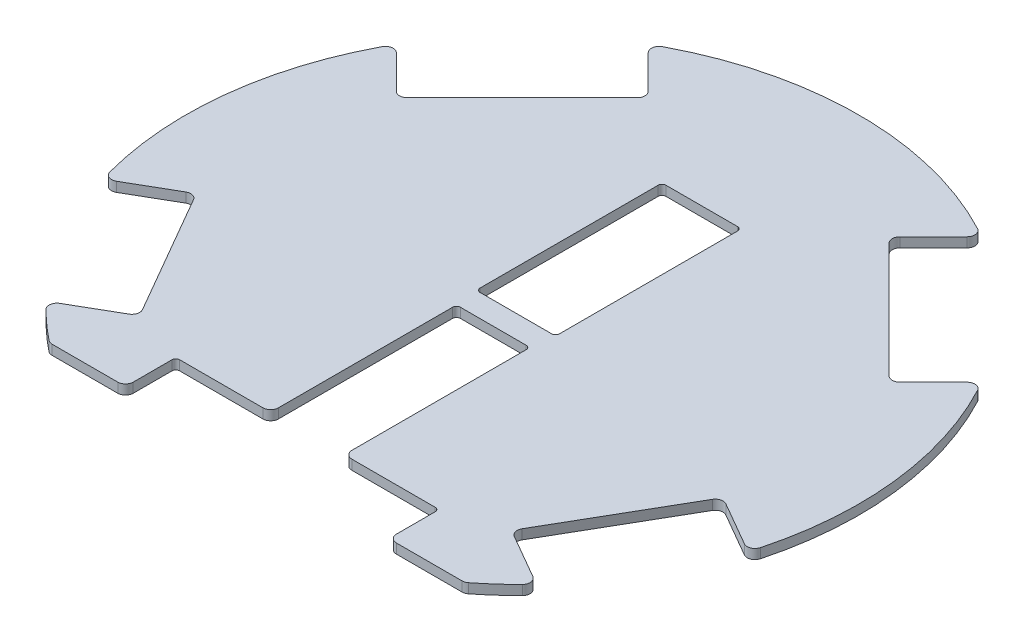
from build123d import *

# Parameters (mm, degrees)
RESSALTO_EXTRUS_O1_DEPTH = 2.5
ESBO_O13_W               = 20.5
ESBO_O13_H               = 48
CORTE_EXTRUS_O8_DEPTH    = 124.061976256
FILETE1_R                = 2
FILETE2_R                = 1


# Read off the part's stored shape, not the designer's step: Ressalto-extrusão1
with BuildPart() as part:
    # Ressalto-extrusão1 outline → Ressalto-extrusão1 (new body)
    with BuildSketch(Plane(origin=(0, 0, 0), x_dir=(1, 0, 0), z_dir=(0, 1, 0))):
        with BuildLine():
            ThreePointArc((41.182170498, 73.709082433), (41.745717904, 75.420720863), (40.703673569, 76.89090296))
            ThreePointArc((40.703673569, 76.89090296), (0, 87), (-40.703673569, 76.89090296))
            ThreePointArc((-40.703673569, 76.89090296), (-41.745717904, 75.420720863), (-41.182170498, 73.709082433))
            Line((-41.182170498, 73.709082433), (-32.526911935, 65.053823869))
            ThreePointArc((-32.526911935, 65.053823869), (-31.941125497, 63.639610306), (-32.526911935, 62.225396744))
            Line((-32.526911935, 62.225396744), (-62.225396744, 32.526911935))
            ThreePointArc((-62.225396744, 32.526911935), (-63.639610306, 31.941125497), (-65.053823869, 32.526911935))
            Line((-65.053823869, 32.526911935), (-73.709082433, 41.182170498))
            ThreePointArc((-73.709082433, 41.182170498), (-75.420720863, 41.745717904), (-76.89090296, 40.703673569))
            ThreePointArc((-76.89090296, 40.703673569), (-86.449685697, 9.769945899), (-84.035651423, -22.516866789))
            ThreePointArc((-84.035651423, -22.516866789), (-82.869168521, -23.846994955), (-81.103797367, -23.731288475))
            Line((-81.103797367, -23.731288475), (-69.755752861, -17.179491924))
            ThreePointArc((-69.755752861, -17.179491924), (-68.238114771, -16.979691079), (-67.023702054, -17.911542732))
            Line((-67.023702054, -17.911542732), (-49.023702054, -49.088457268))
            ThreePointArc((-49.023702054, -49.088457268), (-48.823901209, -50.606095358), (-49.755752861, -51.820508076))
            Line((-49.755752861, -51.820508076), (-61.103797367, -58.372304626))
            ThreePointArc((-61.103797367, -58.372304626), (-62.086687696, -59.843307652), (-61.518004364, -61.518575561))
            ThreePointArc((-61.518004364, -61.518575561), (-57.944854795, -64.895252544), (-54.186675605, -68.064705882))
            ThreePointArc((-54.186675605, -68.064705882), (-53.600773132, -68.388042871), (-52.941004902, -68.5))
            Line((-52.941004902, -68.5), (52.941004902, -68.5))
            ThreePointArc((52.941004902, -68.5), (53.600773132, -68.388042871), (54.186675605, -68.064705882))
            ThreePointArc((54.186675605, -68.064705882), (57.944854795, -64.895252544), (61.518004364, -61.518575561))
            ThreePointArc((61.518004364, -61.518575561), (62.086687696, -59.843307652), (61.103797367, -58.372304626))
            Line((61.103797367, -58.372304626), (49.755752861, -51.820508076))
            ThreePointArc((49.755752861, -51.820508076), (48.823901209, -50.606095358), (49.023702054, -49.088457268))
            Line((49.023702054, -49.088457268), (67.023702054, -17.911542732))
            ThreePointArc((67.023702054, -17.911542732), (68.238114771, -16.979691079), (69.755752861, -17.179491924))
            Line((69.755752861, -17.179491924), (81.103797367, -23.731288475))
            ThreePointArc((81.103797367, -23.731288475), (82.869168521, -23.846994955), (84.035651423, -22.516866789))
            ThreePointArc((84.035651423, -22.516866789), (86.449685697, 9.769945899), (76.89090296, 40.703673569))
            ThreePointArc((76.89090296, 40.703673569), (75.420720863, 41.745717904), (73.709082433, 41.182170498))
            Line((73.709082433, 41.182170498), (65.053823869, 32.526911935))
            ThreePointArc((65.053823869, 32.526911935), (63.639610306, 31.941125497), (62.225396744, 32.526911935))
            Line((62.225396744, 32.526911935), (32.526911935, 62.225396744))
            ThreePointArc((32.526911935, 62.225396744), (31.941125497, 63.639610306), (32.526911935, 65.053823869))
            Line((32.526911935, 65.053823869), (41.182170498, 73.709082433))
        make_face()
    extrude(amount=RESSALTO_EXTRUS_O1_DEPTH)

    # Esboço13 → Corte-extrusão8 (cut, through all)
    with BuildSketch(Plane.XZ):
        with BuildLine():
            ThreePointArc((-9.5, 67.5), (-9.207106781, 68.207106781), (-8.5, 68.5))
            Line((-8.5, 68.5), (-34, 68.5))
            Line((-34, 68.5), (-34, 55.5))
            Line((-34, 55.5), (-9.5, 55.5))
            Line((-9.5, 55.5), (-9.5, 67.5))
        make_face()
        with BuildLine():
            Line((34, 68.5), (8.5, 68.5))
            ThreePointArc((8.5, 68.5), (9.207106781, 68.207106781), (9.5, 67.5))
            Line((9.5, 67.5), (9.5, 55.5))
            Line((9.5, 55.5), (34, 55.5))
            Line((34, 55.5), (34, 68.5))
        make_face()
        with BuildLine():
            Line((8.5, 68.5), (-8.5, 68.5))
            ThreePointArc((-8.5, 68.5), (-9.207106781, 68.207106781), (-9.5, 67.5))
            Line((-9.5, 67.5), (-9.5, 55.5))
            Line((-9.5, 55.5), (9.5, 55.5))
            Line((9.5, 55.5), (9.5, 67.5))
            ThreePointArc((9.5, 67.5), (9.207106781, 68.207106781), (8.5, 68.5))
        make_face()
        with BuildLine():
            Line((9.5, 55.5), (-9.5, 55.5))
            Line((-9.5, 55.5), (-9.5, 8.5))
            ThreePointArc((-9.5, 8.5), (-9.207106781, 7.792893219), (-8.5, 7.5))
            Line((-8.5, 7.5), (8.5, 7.5))
            ThreePointArc((8.5, 7.5), (9.207106781, 7.792893219), (9.5, 8.5))
            Line((9.5, 8.5), (9.5, 55.5))
        make_face()
        with Locations((0, -22.35)):
            Rectangle(ESBO_O13_W, ESBO_O13_H)
    extrude(amount=-CORTE_EXTRUS_O8_DEPTH, mode=Mode.SUBTRACT)

    # Filete1
    filete1_edges = [part.edges().sort_by_distance(p)[0] for p in [
        (-9.5, 1.25, 55.5),
        (-34, 1.25, 68.5),
        (34, 1.25, 68.5),
        (9.5, 1.25, 55.5),
    ]]
    fillet(filete1_edges, radius=FILETE1_R)

    # Filete2
    filete2_edges = [part.edges().sort_by_distance(p)[0] for p in [
        (-34, 1.25, 55.5),
        (34, 1.25, 55.5),
        (-10.25, 1.25, 1.65),
        (10.25, 1.25, 1.65),
        (10.25, 1.25, -46.35),
        (-10.25, 1.25, -46.35),
    ]]
    fillet(filete2_edges, radius=FILETE2_R)


solid = part.part
